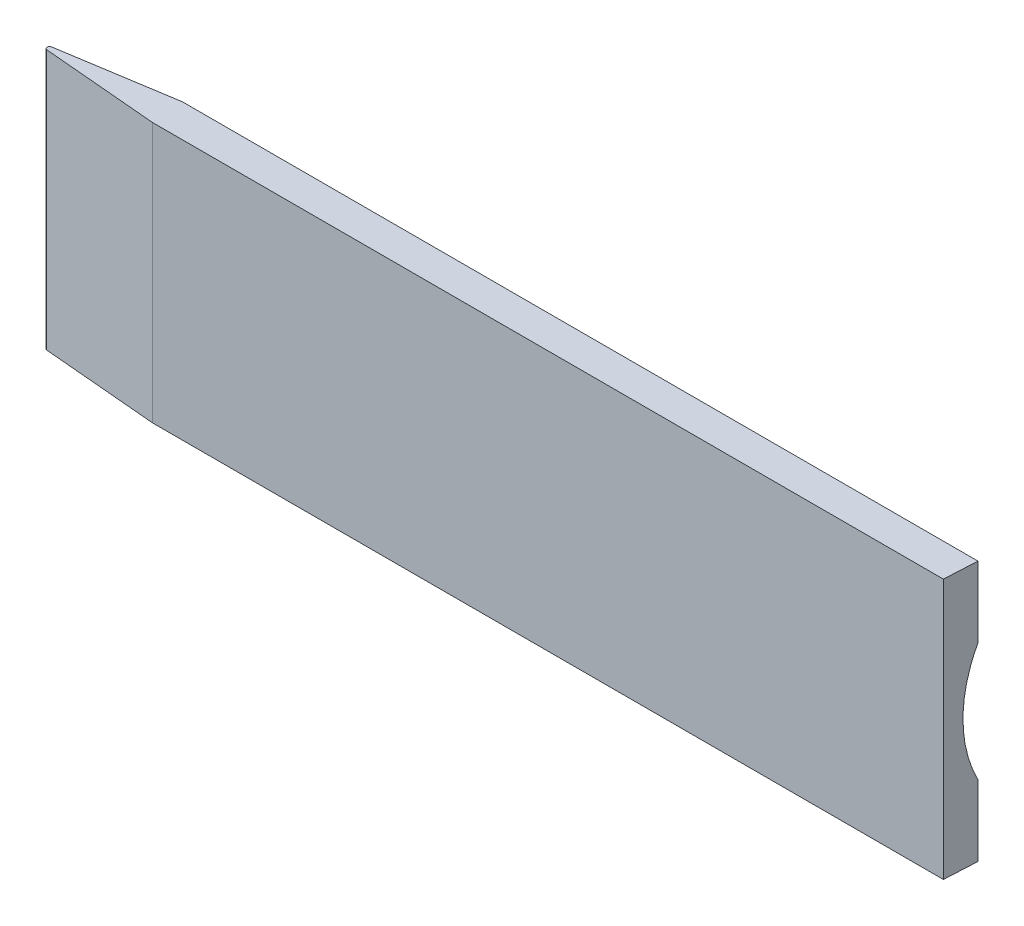
from build123d import *

# Parameters (mm, degrees)
BOSS_EXTRUDE1_DEPTH = 80


with BuildPart() as part:
    # Sketch1 → Boss-Extrude1 (new body)
    with BuildSketch(Plane(origin=(0, 0, 0), x_dir=(1, 0, 0), z_dir=(0, 1, 0))):
        with BuildLine():
            Line((180, 5), (179.469862502, -5.115626071))
            Line((179.469862502, -5.115626071), (-63.767328769, -5.115626071))
            Line((-63.767328769, -5.115626071), (-99.406651233, -1.997589379))
            ThreePointArc((-99.406651233, -1.997589379), (-99.829230269, -1.789196461), (-100, -1.350062826))
            Line((-100, -1.350062826), (-100, -1.154739941))
            ThreePointArc((-100, -1.154739941), (-99.844263878, -0.732598709), (-99.451682402, -0.512742519))
            Line((-99.451682402, -0.512742519), (-64.645595971, 5))
            Line((-64.645595971, 5), (180, 5))
        make_face()
    extrude(amount=BOSS_EXTRUDE1_DEPTH)

    # Cut-Loft2: read off the stored shape, not the designer's step
    # Cut-Loft2: loft between two sections, ruled curve by curve
    cut_loft2_from = [
        Edge.make_bspline([(-100, 46.372269689, -42.924050086), (-100, 47.27138594, -42.658538849), (-100, 48.210787476, -42.320500231), (-100, 50.149850676, -41.453921439), (-100, 51.149765287, -40.925166444), (-100, 53.169114931, -39.628159499), (-100, 54.18874158, -38.859470423), (-100, 56.178772716, -37.039694285), (-100, 57.149111753, -35.987936251), (-100, 58.941067781, -33.581924282), (-100, 59.762113682, -32.226944596), (-100, 61.133842388, -29.23911219), (-100, 61.683362519, -27.605929091), (-100, 62.216554733, -25.013126268), (-100, 62.345428507, -24.125166051), (-100, 62.496577402, -22.320181761), (-100, 62.518852521, -21.403157688), (-100, 62.447919377, -19.558367046), (-100, 62.354526015, -18.630982172), (-100, 62.052716958, -16.78785196), (-100, 61.844301264, -15.872106621), (-100, 61.313278789, -14.073874119), (-100, 60.990797696, -13.191812573), (-100, 60.242941855, -11.480401071), (-100, 59.817567108, -10.651051116), (-100, 58.87497002, -9.063664977), (-100, 58.358110433, -8.305848706), (-100, 57.250681403, -6.872525569), (-100, 56.660111959, -6.197018701), (-100, 54.80395718, -4.309795913), (-100, 53.45539094, -3.237122381), (-100, 50.680622933, -1.473760637), (-100, 49.255217853, -0.782163442), (-100, 46.443698676, 0.264430993), (-100, 45.057669802, 0.620347796), (-100, 42.398313027, 1.067148265), (-100, 41.124675582, 1.158630823), (-100, 38.724689029, 1.150596935), (-100, 37.597941582, 1.051343402), (-100, 35.499184882, 0.725544061), (-100, 34.526846562, 0.499041204), (-100, 32.72861406, -0.03198127), (-100, 31.789212524, -0.370019888), (-100, 29.850149324, -1.23659868), (-100, 28.850234713, -1.765353674), (-100, 26.830885069, -3.062360619), (-100, 25.81125842, -3.831049696), (-100, 23.821227284, -5.650825833), (-100, 22.850888247, -6.702583867), (-100, 21.058932219, -9.108595836), (-100, 20.237886318, -10.463575522), (-100, 18.866157612, -13.451407929), (-100, 18.316637481, -15.084591028), (-100, 17.783445267, -17.677393851), (-100, 17.654571493, -18.565354067), (-100, 17.503422598, -20.370338357), (-100, 17.481147479, -21.287362431), (-100, 17.552080623, -23.132153073), (-100, 17.645473985, -24.059537946), (-100, 17.947283042, -25.902668159), (-100, 18.155698736, -26.818413497), (-100, 18.686721211, -28.616646), (-100, 19.009202304, -29.498707546), (-100, 19.757058145, -31.210119048), (-100, 20.182432892, -32.039469003), (-100, 21.12502998, -33.626855142), (-100, 21.641889567, -34.384671412), (-100, 22.749318597, -35.81799455), (-100, 23.339888041, -36.493501417), (-100, 25.19604282, -38.380724205), (-100, 26.54460906, -39.453397738), (-100, 29.319377067, -41.216759482), (-100, 30.744782147, -41.908356676), (-100, 33.556301324, -42.954951112), (-100, 34.942330198, -43.310867915), (-100, 37.601686973, -43.757668384), (-100, 38.875324418, -43.849150941), (-100, 41.275310971, -43.841117054), (-100, 42.402058418, -43.74186352), (-100, 44.500815118, -43.416064179), (-100, 45.473153438, -43.189561323), (-100, 46.372269689, -42.924050086)], [0, 0, 0, 0, 0.03125, 0.03125, 0.0625, 0.0625, 0.09375, 0.09375, 0.125, 0.125, 0.15625, 0.15625, 0.1875, 0.1875, 0.203125, 0.203125, 0.21875, 0.21875, 0.234375, 0.234375, 0.25, 0.25, 0.265625, 0.265625, 0.28125, 0.28125, 0.296875, 0.296875, 0.3125, 0.3125, 0.34375, 0.34375, 0.375, 0.375, 0.40625, 0.40625, 0.4375, 0.4375, 0.46875, 0.46875, 0.5, 0.5, 0.53125, 0.53125, 0.5625, 0.5625, 0.59375, 0.59375, 0.625, 0.625, 0.65625, 0.65625, 0.6875, 0.6875, 0.703125, 0.703125, 0.71875, 0.71875, 0.734375, 0.734375, 0.75, 0.75, 0.765625, 0.765625, 0.78125, 0.78125, 0.796875, 0.796875, 0.8125, 0.8125, 0.84375, 0.84375, 0.875, 0.875, 0.90625, 0.90625, 0.9375, 0.9375, 0.96875, 0.96875, 1, 1, 1, 1], 3),
    ]
    cut_loft2_to = [
        Edge.make_bspline([(180, 28.551057955, -78.935198824), (180, 30.147996066, -79.412238075), (180, 31.875323965, -79.820338386), (180, 35.604608971, -80.411256005), (180, 37.607151324, -80.593998796), (180, 41.873728161, -80.621685223), (180, 44.138472267, -80.46616369), (180, 48.868689715, -79.68670829), (180, 51.334716697, -79.061711462), (180, 56.338793625, -77.216810774), (180, 58.876697195, -75.995271668), (180, 63.819442208, -72.875919018), (180, 66.222872399, -70.976485062), (180, 69.533227056, -67.631805591), (180, 70.587261439, -66.435254593), (180, 72.564064486, -63.89331443), (180, 73.486743413, -62.547940775), (180, 75.171328923, -59.731199346), (180, 75.933152653, -58.259880816), (180, 77.272256632, -55.221524011), (180, 77.849475409, -53.654564318), (180, 78.803553913, -50.460688096), (180, 79.18038475, -48.83386828), (180, 79.727221351, -45.558844421), (180, 79.897235414, -43.910739803), (180, 80.033641397, -40.631524344), (180, 80.000075583, -39.000500123), (180, 79.741415418, -35.790779731), (180, 79.516387593, -34.212145749), (180, 78.582975921, -29.599763352), (180, 77.615177464, -26.693271965), (180, 75.193247864, -21.373934955), (180, 73.741185532, -18.960508489), (180, 70.568939332, -14.673166832), (180, 68.849774783, -12.797964612), (180, 65.322122641, -9.551708587), (180, 63.513755151, -8.179462312), (180, 59.931061785, -5.862405409), (180, 58.156397702, -4.916816601), (180, 54.714031128, -3.36540993), (180, 53.045880155, -2.759208753), (180, 49.852003934, -1.80513025), (180, 48.124676035, -1.39702994), (180, 44.395391029, -0.80611232), (180, 42.392848676, -0.623369529), (180, 38.126271839, -0.595683102), (180, 35.861527733, -0.751204636), (180, 31.131310285, -1.530660035), (180, 28.665283303, -2.155656863), (180, 23.661206375, -4.000557551), (180, 21.123302805, -5.222096657), (180, 16.180557792, -8.341449307), (180, 13.777127601, -10.240883263), (180, 10.466772944, -13.585562734), (180, 9.412738561, -14.782113732), (180, 7.435935514, -17.324053895), (180, 6.513256587, -18.66942755), (180, 4.828671077, -21.486168979), (180, 4.066847347, -22.957487509), (180, 2.727743368, -25.995844314), (180, 2.150524591, -27.562804007), (180, 1.196446087, -30.756680229), (180, 0.81961525, -32.383500046), (180, 0.272778649, -35.658523904), (180, 0.102764586, -37.306628522), (180, -0.033641397, -40.585843981), (180, -7.5583e-05, -42.216868202), (180, 0.258584582, -45.426588594), (180, 0.483612407, -47.005222577), (180, 1.417024079, -51.617604973), (180, 2.384822536, -54.52409636), (180, 4.806752136, -59.84343337), (180, 6.258814468, -62.256859836), (180, 9.431060668, -66.544201493), (180, 11.150225217, -68.419403713), (180, 14.677877359, -71.665659739), (180, 16.486244849, -73.037906013), (180, 20.068938215, -75.354962916), (180, 21.843602298, -76.300551724), (180, 25.285968872, -77.851958395), (180, 26.954119845, -78.458159572), (180, 28.551057955, -78.935198824)], [0, 0, 0, 0, 0.03125, 0.03125, 0.0625, 0.0625, 0.09375, 0.09375, 0.125, 0.125, 0.15625, 0.15625, 0.1875, 0.1875, 0.203125, 0.203125, 0.21875, 0.21875, 0.234375, 0.234375, 0.25, 0.25, 0.265625, 0.265625, 0.28125, 0.28125, 0.296875, 0.296875, 0.3125, 0.3125, 0.34375, 0.34375, 0.375, 0.375, 0.40625, 0.40625, 0.4375, 0.4375, 0.46875, 0.46875, 0.5, 0.5, 0.53125, 0.53125, 0.5625, 0.5625, 0.59375, 0.59375, 0.625, 0.625, 0.65625, 0.65625, 0.6875, 0.6875, 0.703125, 0.703125, 0.71875, 0.71875, 0.734375, 0.734375, 0.75, 0.75, 0.765625, 0.765625, 0.78125, 0.78125, 0.796875, 0.796875, 0.8125, 0.8125, 0.84375, 0.84375, 0.875, 0.875, 0.90625, 0.90625, 0.9375, 0.9375, 0.96875, 0.96875, 1, 1, 1, 1], 3),
    ]
    cut_loft2 = Solid(Shell([*[Face.make_surface_from_curves(cut_loft2_from[k], cut_loft2_to[k]) for k in range(1)], Face(Wire(cut_loft2_from)), Face(Wire(cut_loft2_to))]))
    add(cut_loft2, mode=Mode.SUBTRACT)


solid = part.part
